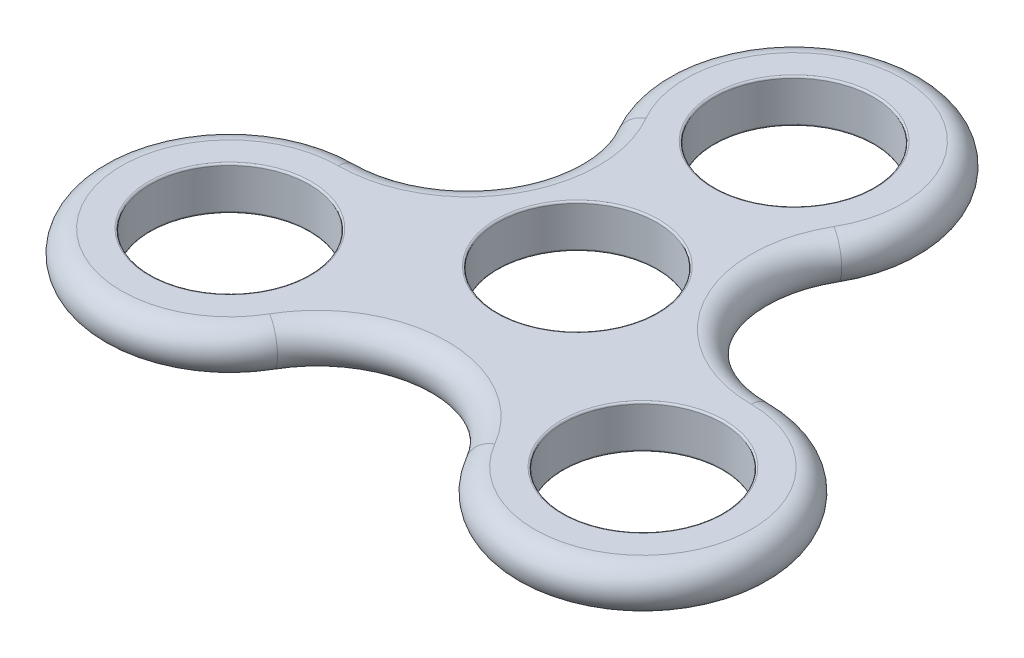
from build123d import *

# Parameters (mm, degrees)
SKETCH1_R           = 11
BOSS_EXTRUDE2_DEPTH = 6
FILLET1_R           = 3
FILLET2_R           = 0.25


with BuildPart() as part:
    # Sketch1 → Boss-Extrude2 (new body)
    with BuildSketch(Plane(origin=(0, 0, 0), x_dir=(1, 0, 0), z_dir=(0, 1, 0))):
        with BuildLine():
            ThreePointArc((-28.578838325, -1.5), (-44.167295593, -28.5), (-12.990381057, -28.5))
            ThreePointArc((-12.990381057, -28.5), (0, -21), (12.990381057, -28.5))
            ThreePointArc((12.990381057, -28.5), (44.167295593, -28.5), (28.578838325, -1.5))
            ThreePointArc((28.578838325, -1.5), (15.588457268, 6), (15.588457268, 21))
            ThreePointArc((15.588457268, 21), (0, 48), (-15.588457268, 21))
            ThreePointArc((-15.588457268, 21), (-15.588457268, 6), (-28.578838325, -1.5))
        make_face()
        with Locations(Location((0, 0, 0), (0, 0, 270))):
            Circle(SKETCH1_R, mode=Mode.SUBTRACT)
        with Locations(Location((0, 30, 0), (0, 0, 270))):
            Circle(SKETCH1_R, mode=Mode.SUBTRACT)
        with Locations(Location((28.578838325, -19.5, 0), (0, 0, 270))):
            Circle(SKETCH1_R, mode=Mode.SUBTRACT)
        with Locations(Location((-28.578838325, -19.5, 0), (0, 0, 270))):
            Circle(SKETCH1_R, mode=Mode.SUBTRACT)
    extrude(amount=BOSS_EXTRUDE2_DEPTH)

    # Fillet1
    fillet1_edges = [part.edges().sort_by_distance(p)[0] for p in [
        (0, 6, 21),
        (-15.588457268, 3, -21),
        (15.588457268, 3, -21),
        (28.578838325, 3, 1.5),
        (12.990381057, 3, 28.5),
        (-12.990381057, 3, 28.5),
        (-28.578838325, 3, 1.5),
        (44.167295593, 6, 28.5),
        (15.588457268, 6, -6),
        (0, 6, -48),
        (-15.588457268, 6, -6),
        (0, 0, -48),
        (15.588457268, 0, -6),
        (44.167295593, 0, 28.5),
        (-44.167295593, 6, 28.5),
        (0, 0, 21),
        (-44.167295593, 0, 28.5),
        (-15.588457268, 0, -6),
    ]]
    fillet(fillet1_edges, radius=FILLET1_R - 0.0001)  # a hair under: the kernel refuses the full size

    # Fillet2
    fillet2_edges = [part.edges().sort_by_distance(p)[0] for p in [
        (0, 0, -11),
        (0, 6, -11),
        (0, 0, -41),
        (0, 6, -41),
        (28.578838325, 0, 8.5),
        (28.578838325, 6, 8.5),
        (-28.578838325, 0, 8.5),
        (-28.578838325, 6, 8.5),
    ]]
    fillet(fillet2_edges, radius=FILLET2_R)


solid = part.part
